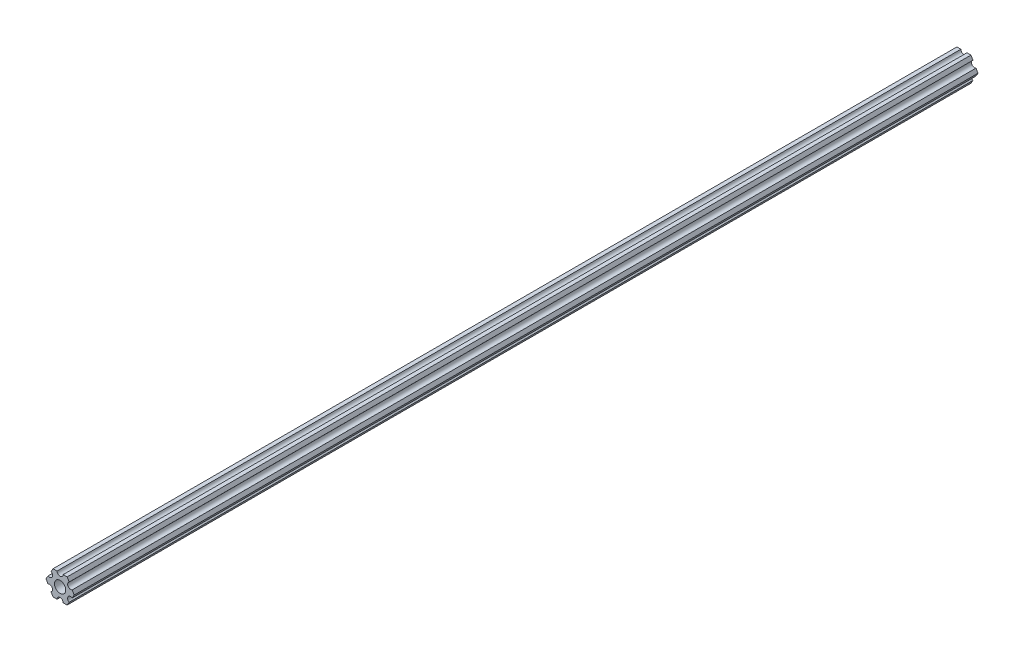
from build123d import *

# Parameters (mm, degrees)
SKETCH1_R           = 2.9337
BOSS_EXTRUDE1_DEPTH = 234.95


with BuildPart() as part:
    # Sketch1 → Boss-Extrude1 (new, symmetric)
    with BuildSketch(Plane.XY):
        with BuildLine():
            Line((-4.70551159, -4.549815043), (-3.666174521, -6.349999904))
            Line((-3.666174521, -6.349999904), (-1.587500769, -6.349999904))
            ThreePointArc((-1.587500769, -6.349999904), (-3.85e-07, -4.762499519), (1.587500769, -6.349999904))
            Line((1.587500769, -6.349999904), (3.666173825, -6.349999904))
            Line((3.666173825, -6.349999904), (4.705510929, -4.549815232))
            ThreePointArc((4.705510929, -4.549815232), (4.124445601, -2.381249904), (6.293010929, -1.800184575))
            Line((6.293010929, -1.800184575), (7.332348034, 9.6e-08))
            Line((7.332348034, 9.6e-08), (6.293011178, 1.800184715))
            ThreePointArc((6.293011178, 1.800184715), (4.124445902, 2.381250241), (4.705511428, 4.549815516))
            Line((4.705511428, 4.549815516), (3.666174521, 6.350000222))
            Line((3.666174521, 6.350000222), (1.587499231, 6.350000222))
            ThreePointArc((1.587499231, 6.350000222), (3.85e-07, 4.762501376), (-1.587499231, 6.350000222))
            Line((-1.587499231, 6.350000222), (-3.666173825, 6.350000222))
            Line((-3.666173825, 6.350000222), (-4.705511038, 4.549815614))
            ThreePointArc((-4.705511038, 4.549815614), (-4.124445841, 2.38125025), (-6.293011205, 1.800185053))
            Line((-6.293011205, 1.800185053), (-7.332348419, 4.44e-07))
            Line((-7.332348419, 4.44e-07), (-6.293011423, -1.80018429))
            ThreePointArc((-6.293011423, -1.80018429), (-4.12444613, -2.38124975), (-4.70551159, -4.549815043))
        make_face()
        Circle(SKETCH1_R, mode=Mode.SUBTRACT)
    extrude(amount=BOSS_EXTRUDE1_DEPTH, both=True)


solid = part.part
